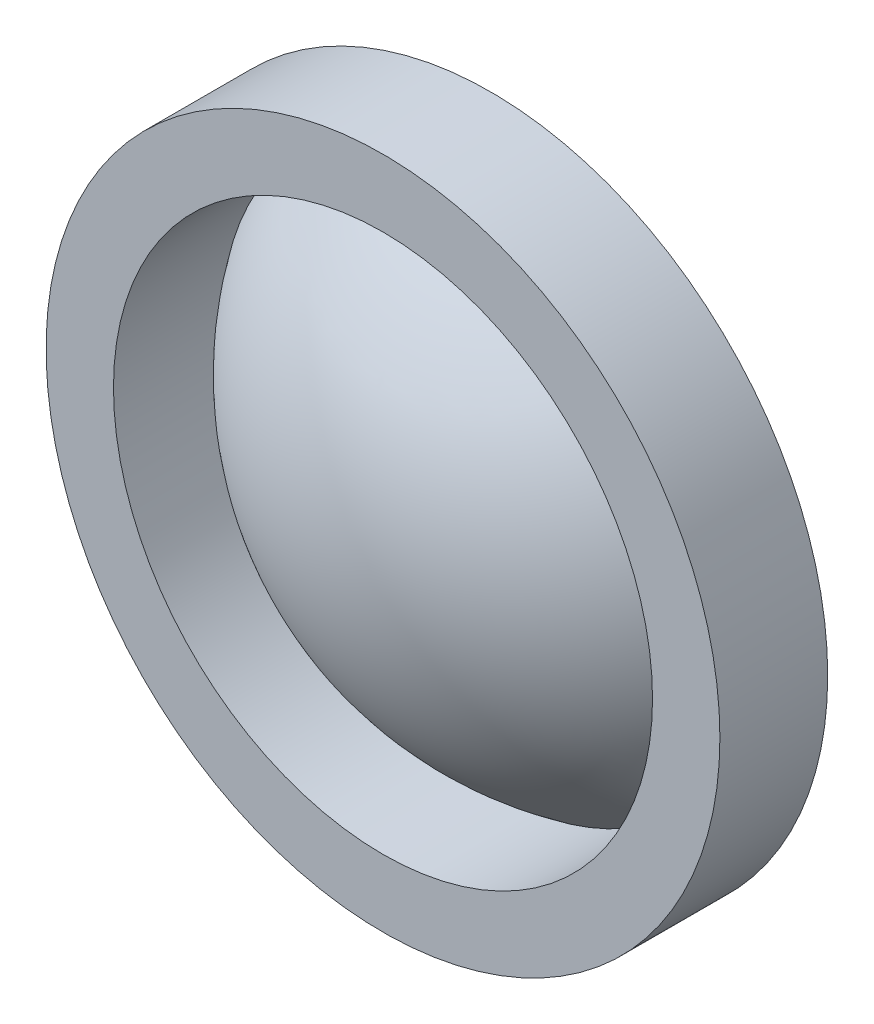
from build123d import *

# Parameters (mm, degrees)
SKETCH2_R           = 1250
SKETCH2_R_2         = 1000
BOSS_EXTRUDE1_DEPTH = 400


with BuildPart() as part:
    # Sketch2 → Boss-Extrude1 (new body)
    with BuildSketch(Plane.XY):
        Circle(SKETCH2_R)
        Circle(SKETCH2_R_2, mode=Mode.SUBTRACT)
    extrude(amount=BOSS_EXTRUDE1_DEPTH)


with BuildPart() as body_2:
    # Sketch3 → Revolve2 (revolve)
    with BuildSketch(Plane(origin=(0, 0, 0), x_dir=(0, 0, -1), z_dir=(1, 0, 0))):
        with BuildLine():
            Line((0, 0), (0, -1000))
            ThreePointArc((0, -1000), (-388.426591115, -565.59211788), (-528.75114679, 0))
            Line((-528.75114679, 0), (0, 0))
        make_face()
    revolve(axis=Axis((0, 0, 0), (0, 0, 1)))


solid = Compound([part.part, body_2.part])
